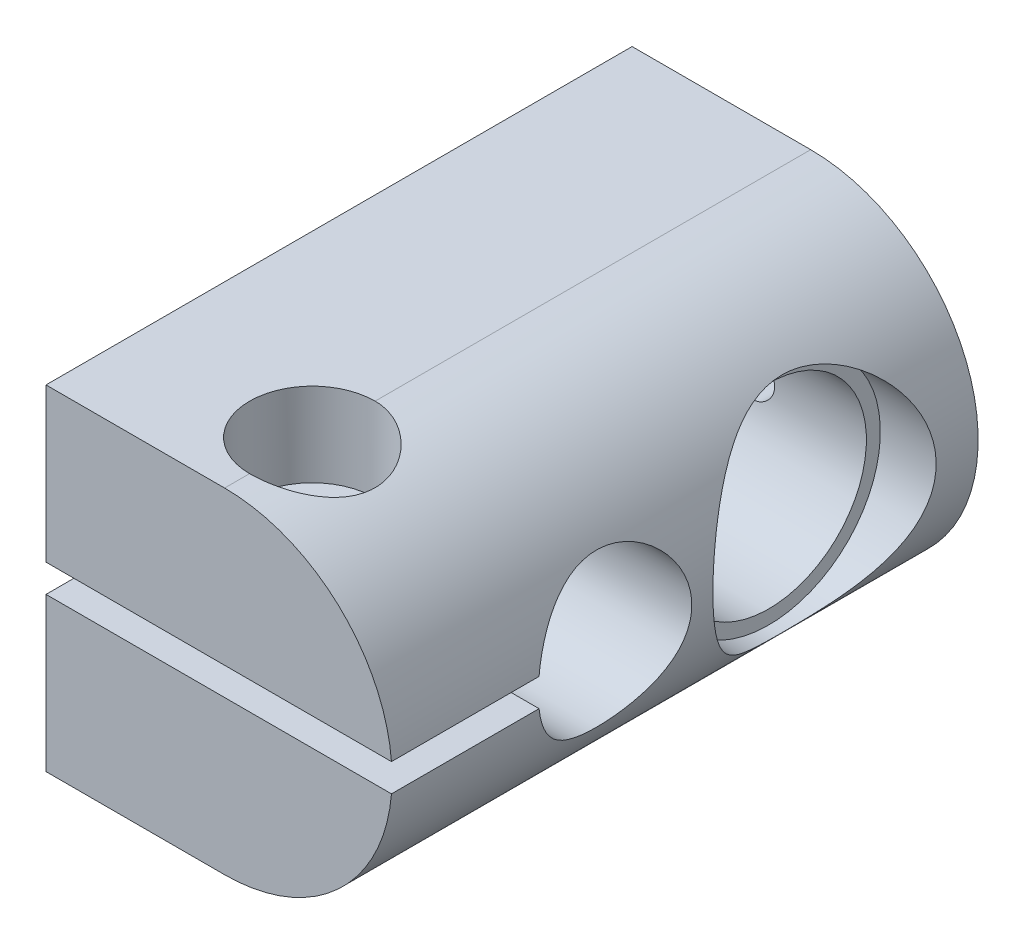
from build123d import *

# Parameters (mm, degrees)
SKETCH1_W              = 9.525
SKETCH1_H              = 33.3375
COMBINE1_START         = -168.91
COMBINE1_OUTLINE_R     = 5.55625
COMBINE1_DEPTH         = 20.91
COMBINE1_START_2       = -152.4
COMBINE1_2_OUTLINE_R   = 6.35
COMBINE1_2_OUTLINE_R_2 = 5.55625
COMBINE1_2_DEPTH       = 4.4
COMBINE1_START_3       = -166.890966931
COMBINE1_3_OUTLINE_R   = 1.0795
COMBINE1_3_DEPTH       = 2.743466931
COMBINE1_4_OUTLINE_R   = 1.0795
COMBINE1_4_OUTLINE_R_2 = 6.35
COMBINE1_4_DEPTH       = 10.107803
COMBINE1_5_OUTLINE_R   = 6.35
COMBINE1_5_OUTLINE_R_2 = 5.55625
COMBINE1_5_DEPTH       = 4.7625
COMBINE1_START_4       = -164.1475
COMBINE1_6_OUTLINE_R   = 1.0795
COMBINE1_6_DEPTH       = 1.8256249
COMBINE1_START_5       = 4.7625
COMBINE1_7_OUTLINE_R   = 3.571875
COMBINE1_7_DEPTH       = 4.7625
COMBINE1_START_6       = -11
COMBINE1_8_OUTLINE_R   = 1.7272
COMBINE1_8_DEPTH       = 15.7625
COMBINE1_START_7       = 0.793749963
COMBINE1_9_OUTLINE_R   = 2.1844
COMBINE1_9_OUTLINE_R_2 = 1.7272
COMBINE1_9_DEPTH       = 3.968750037
COMBINE1_START_8       = -33.3375
COMBINE1_10_OUTLINE_R  = 1.1303
COMBINE1_10_DEPTH      = 3.297532088


with BuildPart() as part:
    # Sketch1 → Revolve1 (revolve)
    with BuildSketch(Plane(origin=(0, 0, 0), x_dir=(1, 0, 0), z_dir=(0, 1, 0))):
        with Locations((-153.9875, 16.66875)):
            Rectangle(SKETCH1_W, SKETCH1_H)
    revolve(axis=Axis((-158.75, 0, 0), (0, 0, -1)))

    # Combine1: read off the stored shape, not the designer's step
    # Combine1 outline → Combine1 (cut)
    with BuildSketch(Plane.YZ.offset(COMBINE1_START)):
        with BuildLine():
            Line((0.79375, 0), (-0.79375, 0))
            Line((-0.79375, 0), (-0.793749936, -8.394440501))
            ThreePointArc((-0.793749936, -8.394440501), (-1e-08, -17.052925), (0.793749959, -8.394440505))
            Line((0.793749959, -8.394440505), (0.79375, 0))
        make_face()
        with Locations((0, -24.5999)):
            Circle(COMBINE1_OUTLINE_R)
    extrude(amount=COMBINE1_DEPTH, mode=Mode.SUBTRACT)

    # Combine1 2 outline → Combine1 2 (cut)
    with BuildSketch(Plane.YZ.offset(COMBINE1_START_2)):
        with Locations((0, -24.5999)):
            Circle(COMBINE1_2_OUTLINE_R)
        with Locations((0, -24.5999)):
            Circle(COMBINE1_2_OUTLINE_R_2, mode=Mode.SUBTRACT)
    extrude(amount=COMBINE1_2_DEPTH, mode=Mode.SUBTRACT)

    # Combine1 3 outline → Combine1 3 (cut)
    with BuildSketch(Plane.YZ.offset(COMBINE1_START_3)):
        with Locations((7.14375, -19.8374)):
            Circle(COMBINE1_3_OUTLINE_R)
        with Locations((-7.14375, -29.3624)):
            Circle(COMBINE1_3_OUTLINE_R)
    extrude(amount=COMBINE1_3_DEPTH, mode=Mode.SUBTRACT)

    # Combine1 4 outline → Combine1 4 (add)
    with BuildSketch(Plane.YZ.offset(COMBINE1_START)):
        with BuildLine():
            Line((-9.525, 0), (-9.525, -33.3375))
            Line((-9.525, -33.3375), (9.525, -33.3375))
            Line((9.525, -33.3375), (9.525, 0))
            Line((9.525, 0), (0.79375, 0))
            Line((0.79375, 0), (0.793749959, -8.394440505))
            ThreePointArc((0.793749959, -8.394440505), (-1e-08, -17.052925), (-0.793749936, -8.394440501))
            Line((-0.793749936, -8.394440501), (-0.79375, 0))
            Line((-0.79375, 0), (-9.525, 0))
        make_face()
        with Locations((-7.14375, -29.3624)):
            Circle(COMBINE1_4_OUTLINE_R, mode=Mode.SUBTRACT)
        with Locations((0, -24.5999)):
            Circle(COMBINE1_4_OUTLINE_R_2, mode=Mode.SUBTRACT)
        with Locations((7.14375, -19.8374)):
            Circle(COMBINE1_4_OUTLINE_R, mode=Mode.SUBTRACT)
    extrude(amount=COMBINE1_4_DEPTH)

    # Combine1 5 outline → Combine1 5 (add)
    with BuildSketch(Plane.YZ.offset(COMBINE1_START)):
        with Locations((0, -24.5999)):
            Circle(COMBINE1_5_OUTLINE_R)
        with Locations((0, -24.5999)):
            Circle(COMBINE1_5_OUTLINE_R_2, mode=Mode.SUBTRACT)
    extrude(amount=COMBINE1_5_DEPTH)

    # Combine1 6 outline → Combine1 6 (add)
    with BuildSketch(Plane.YZ.offset(COMBINE1_START_4)):
        with Locations((7.14375, -19.8374)):
            Circle(COMBINE1_6_OUTLINE_R)
        with Locations((-7.14375, -29.3624)):
            Circle(COMBINE1_6_OUTLINE_R)
    extrude(amount=COMBINE1_6_DEPTH)

    # Combine1 7 outline → Combine1 7 (cut)
    with BuildSketch(Plane(origin=(0, 0, 0), x_dir=(1, 0, 0), z_dir=(0, 1, 0)).offset(COMBINE1_START_5)):
        with Locations((-158.75, 4.9911)):
            Circle(COMBINE1_7_OUTLINE_R)
    extrude(amount=COMBINE1_7_DEPTH, mode=Mode.SUBTRACT)

    # Combine1 8 outline → Combine1 8 (cut)
    with BuildSketch(Plane(origin=(0, 0, 0), x_dir=(1, 0, 0), z_dir=(0, 1, 0)).offset(COMBINE1_START_6)):
        with Locations((-158.75, 4.9911)):
            Circle(COMBINE1_8_OUTLINE_R)
    extrude(amount=COMBINE1_8_DEPTH, mode=Mode.SUBTRACT)

    # Combine1 9 outline → Combine1 9 (cut)
    with BuildSketch(Plane(origin=(0, 0, 0), x_dir=(1, 0, 0), z_dir=(0, 1, 0)).offset(COMBINE1_START_7)):
        with Locations((-158.75, 4.9911)):
            Circle(COMBINE1_9_OUTLINE_R)
        with Locations((-158.75, 4.9911)):
            Circle(COMBINE1_9_OUTLINE_R_2, mode=Mode.SUBTRACT)
    extrude(amount=COMBINE1_9_DEPTH, mode=Mode.SUBTRACT)

    # Combine1 10 outline → Combine1 10 (cut)
    with BuildSketch(Plane.XY.offset(COMBINE1_START_8)):
        with Locations((-158.75, 0)):
            Circle(COMBINE1_10_OUTLINE_R)
    extrude(amount=COMBINE1_10_DEPTH, mode=Mode.SUBTRACT)


solid = part.part
